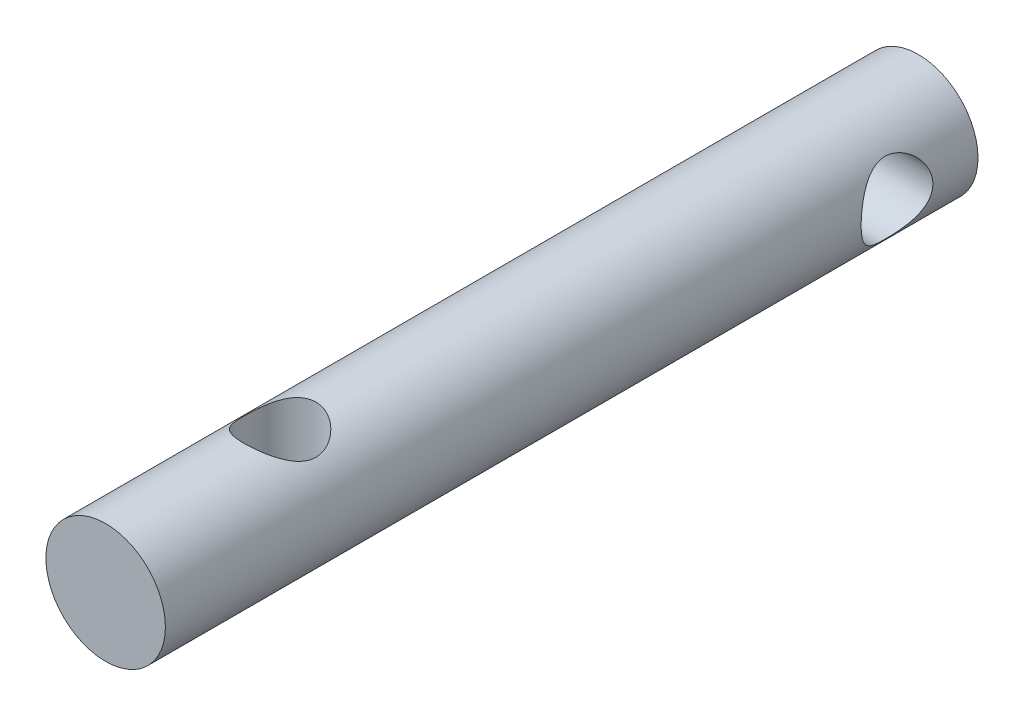
from build123d import *

# Parameters (mm, degrees)
SKETCH1_R               = 3.175
BOSS_EXTRUDE1_DEPTH     = 43.18
CUT_EXTRUDE1_DEPTH      = 44.412828173
CUT_EXTRUDE1_DEPTH_BACK = 44.412828173
SKETCH2_R               = 1.905
CUT_EXTRUDE2_DEPTH      = 44.412828288
CUT_EXTRUDE2_DEPTH_BACK = 44.412828288
SKETCH3_R               = 1.905


with BuildPart() as part:
    # Sketch1 → Boss-Extrude1 (new body)
    with BuildSketch(Plane.XY):
        Circle(SKETCH1_R)
    extrude(amount=BOSS_EXTRUDE1_DEPTH)

    # Sketch2 → Cut-Extrude1 (cut, two sides: drawn at the far end of the back side and taken through both)
    with BuildSketch(Plane(origin=(0, 0, 0), x_dir=(1, 0, 0), z_dir=(0, 1, 0)).offset(-CUT_EXTRUDE1_DEPTH_BACK)):
        with Locations((0, -33.909)):
            Circle(SKETCH2_R)
    extrude(amount=CUT_EXTRUDE1_DEPTH + CUT_EXTRUDE1_DEPTH_BACK, mode=Mode.SUBTRACT)

    # Sketch3 → Cut-Extrude2 (cut, two sides: drawn at the far end of the back side and taken through both)
    with BuildSketch(Plane(origin=(0, 0, 0), x_dir=(0, 0, -1), z_dir=(1, 0, 0)).offset(-CUT_EXTRUDE2_DEPTH_BACK)):
        with Locations((-4.303139223, 0)):
            Circle(SKETCH3_R)
    extrude(amount=CUT_EXTRUDE2_DEPTH + CUT_EXTRUDE2_DEPTH_BACK, mode=Mode.SUBTRACT)


solid = part.part
